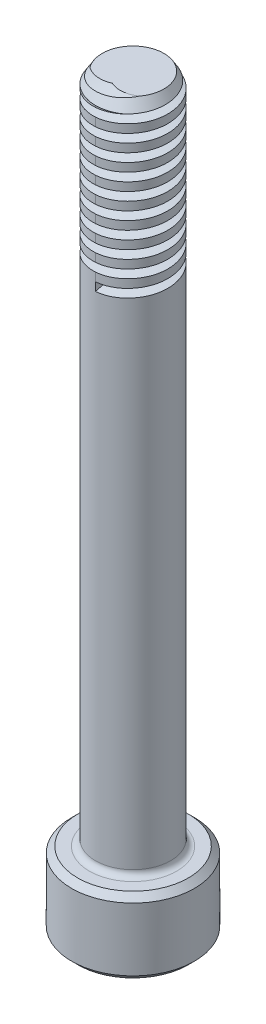
from build123d import *

# Parameters (mm, degrees)
CUT_SWEEP1_PITCH   = 0.635
CUT_EXTRUDE1_DEPTH = 1.2954
FILLET1_R          = 0.2286
FILLET2_R          = 0.396875794
CHAMFER2_SIZE      = 0.2286
CHAMFER3_SIZE      = 0.127


with BuildPart() as part:
    # Sketch1 → Revolve1 (revolve)
    with BuildSketch(Plane.XY, mode=Mode.PRIVATE) as revolve1_sk:
        Polygon((0, 0), (0, 28.2448), (1.4224, 28.2448), (1.4224, 2.8448), (2.3241, 2.8448), (2.3241, 0), align=None)
    revolve(revolve1_sk.sketch.rotate(Axis((0, 0, 0), (0, 1, 0)), 90), axis=Axis((0, 0, 0), (0, 1, 0)))

    # Cut-Sweep1: arcs per turn and ends read off the stored shape
    # Cut-Sweep1: the profile of Sketch3 profile screwed along a right-hand helix through 11 turns, 6 arcs to a turn; built about Z, then put on its axis
    cut_sweep1_z = Axis((0, 0, 0), (0, 0, 1))
    cut_sweep1_corners = [(1.4227, 0, -0.476175), (1.4227, 0, -0.793825), (0.78739873, 0, -0.635)]
    with BuildLine(mode=Mode.PRIVATE) as cut_sweep1_profile:
        Line(cut_sweep1_corners[0], cut_sweep1_corners[1])
        Line(cut_sweep1_corners[1], cut_sweep1_corners[2])
        Line(cut_sweep1_corners[2], cut_sweep1_corners[0])
    cut_sweep1_cap = Face(cut_sweep1_profile.wire())
    cut_sweep1_turn_angles = [0, 30, 60, 90, 120, 150, 180, 210, 240, 270, 300, 330, 360]
    cut_sweep1_turn_weights = [1, 0.8660254037844387, 1, 0.8660254037844387, 1, 0.8660254037844387, 1, 0.8660254037844387, 1, 0.8660254037844387, 1, 0.8660254037844387, 1]
    cut_sweep1_turn_rails = [Edge.make_bspline([Vector(p[0], p[1], 0).rotate(cut_sweep1_z, cut_sweep1_turn_angles[k]) / cut_sweep1_turn_weights[k] + Vector(0, 0, p[2] + CUT_SWEEP1_PITCH * cut_sweep1_turn_angles[k] / 360) for k in range(13)], [0, 0, 0, 1, 1, 2, 2, 3, 3, 4, 4, 5, 5, 6, 6, 6], 2, cut_sweep1_turn_weights) for p in cut_sweep1_corners]
    cut_sweep1_turn_sides = [Face.make_surface_from_curves(cut_sweep1_turn_rails[p[0]], cut_sweep1_turn_rails[p[1]]) for p in [(0, 1), (1, 2), (2, 0)]]
    cut_sweep1 = Plane(origin=(0, 28.2448, 0), x_dir=(0, 0, 1), z_dir=(0, -1, 0)) * Solid(Shell([*[p.moved(Location((0, 0, CUT_SWEEP1_PITCH * i))) for i in range(11) for p in cut_sweep1_turn_sides], cut_sweep1_cap, cut_sweep1_cap.rotate(cut_sweep1_z, 3960).moved(Location((0, 0, CUT_SWEEP1_PITCH * 3960 / 360)))]))
    add(cut_sweep1, mode=Mode.SUBTRACT)

    # Sketch4 → Cut-Extrude1 (cut)
    with BuildSketch(Plane(origin=(0, 0, 0), x_dir=(1, 0, 0), z_dir=(0, 1, 0))):
        Polygon((0, 1.378481503), (-1.1938, 0.689240751), (-1.1938, -0.689240751), (0, -1.378481503), (1.1938, -0.689240751), (1.1938, 0.689240751), align=None)
    extrude(amount=CUT_EXTRUDE1_DEPTH, mode=Mode.SUBTRACT)

    # Fillet1
    fillet1_edges = [part.edges().sort_by_distance(p)[0] for p in [
        (0, 2.8448, 1.4224),
    ]]
    fillet(fillet1_edges, radius=FILLET1_R)

    # Fillet2
    fillet2_edges = [part.edges().sort_by_distance(p)[0] for p in [
        (1.1938, 0.6477, -0.689240751),
        (0, 0.6477, -1.378481503),
        (-1.1938, 0.6477, -0.689240751),
        (-1.1938, 0.6477, 0.689240751),
        (0, 0.6477, 1.378481503),
        (1.1938, 0.6477, 0.689240751),
        (0.5969, 1.2954, -1.033861127),
        (-0.5969, 1.2954, -1.033861127),
        (-1.1938, 1.2954, 0),
        (-0.5969, 1.2954, 1.033861127),
        (0.5969, 1.2954, 1.033861127),
        (1.1938, 1.2954, 0),
    ]]
    fillet(fillet2_edges, radius=FILLET2_R)

    # Chamfer1: read off the stored shape, not the designer's step
    # Chamfer1 outline → Chamfer1 (revolve, cut)
    with BuildSketch(Plane.XY):
        Polygon((1.4224, 28.2448), (1.168399492, 28.2448), (1.4224, 27.833376279), align=None)
    revolve(axis=Axis((0, 0, 0), (0, 1, 0)), mode=Mode.SUBTRACT)

    # Chamfer2
    chamfer2_edges = [part.edges().sort_by_distance(p)[0] for p in [
        (0, 0, 2.3241),
        (0, 2.8448, 2.3241),
    ]]
    chamfer(chamfer2_edges, length=CHAMFER2_SIZE)

    # Chamfer3
    chamfer3_edges = [part.edges().sort_by_distance(p)[0] for p in [
        (0.5969, 0, -1.033861127),
        (-0.5969, 0, -1.033861127),
        (-1.1938, 0, 0),
        (-0.5969, 0, 1.033861127),
        (0.5969, 0, 1.033861127),
        (1.1938, 0, 0),
        (0, 0, -1.317084604),
        (1.140628726, 0, -0.658542302),
        (1.140628726, 0, 0.658542302),
        (0, 0, 1.317084604),
        (-1.140628726, 0, 0.658542302),
        (-1.140628726, 0, -0.658542302),
    ]]
    chamfer(chamfer3_edges, length=CHAMFER3_SIZE)


solid = part.part
